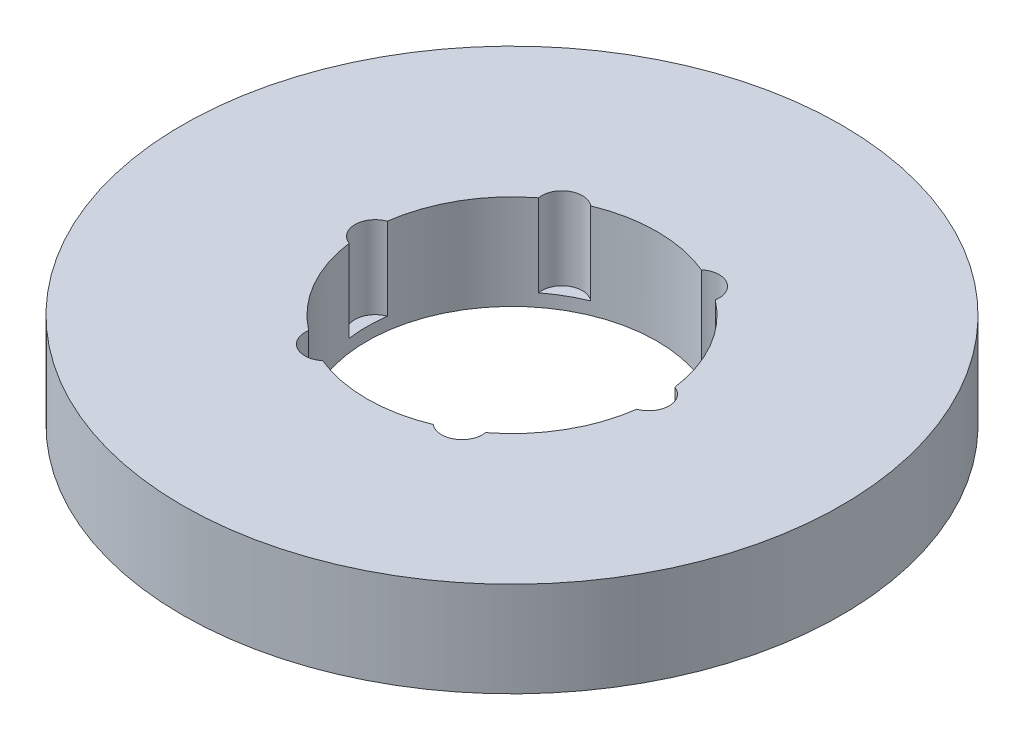
from build123d import *

# Parameters (mm, degrees)
SKETCH1_R           = 62.5
BOSS_EXTRUDE1_DEPTH = 18
SKETCH2_R           = 27.5
CUT_EXTRUDE1_DEPTH  = 91.202549853
SKETCH3_R           = 3.859440813
CUT_EXTRUDE2_DEPTH  = 15.605006108
CIRPATTERN1_COUNT   = 6


with BuildPart() as part:
    # Sketch1 → Boss-Extrude1 (new body)
    with BuildSketch(Plane(origin=(0, 0, 0), x_dir=(1, 0, 0), z_dir=(0, 1, 0))):
        Circle(SKETCH1_R)
    extrude(amount=BOSS_EXTRUDE1_DEPTH)

    # Sketch2 → Cut-Extrude1 (cut, through all)
    with BuildSketch(Plane(origin=(0, 0, 0), x_dir=(1, 0, 0), z_dir=(0, 1, 0))):
        Circle(SKETCH2_R)
    extrude(amount=CUT_EXTRUDE1_DEPTH, mode=Mode.SUBTRACT)

    # Sketch3 → Cut-Extrude2 (cut)
    with BuildSketch(Plane(origin=(0, 18, 0), x_dir=(1, 0, 0), z_dir=(0, 1, 0))):
        with Locations((-25.929979996, 0)):
            Circle(SKETCH3_R)
    cut_extrude2 = extrude(amount=-CUT_EXTRUDE2_DEPTH, mode=Mode.SUBTRACT)

    # CirPattern1: Cut-Extrude2 ×6 about axis
    cirpattern1_axis = Axis((0, 0, 0), (0, 1, 0))
    for i in range(1, CIRPATTERN1_COUNT):
        add(cut_extrude2.rotate(cirpattern1_axis, i * 360 / CIRPATTERN1_COUNT), mode=Mode.SUBTRACT)


solid = part.part
